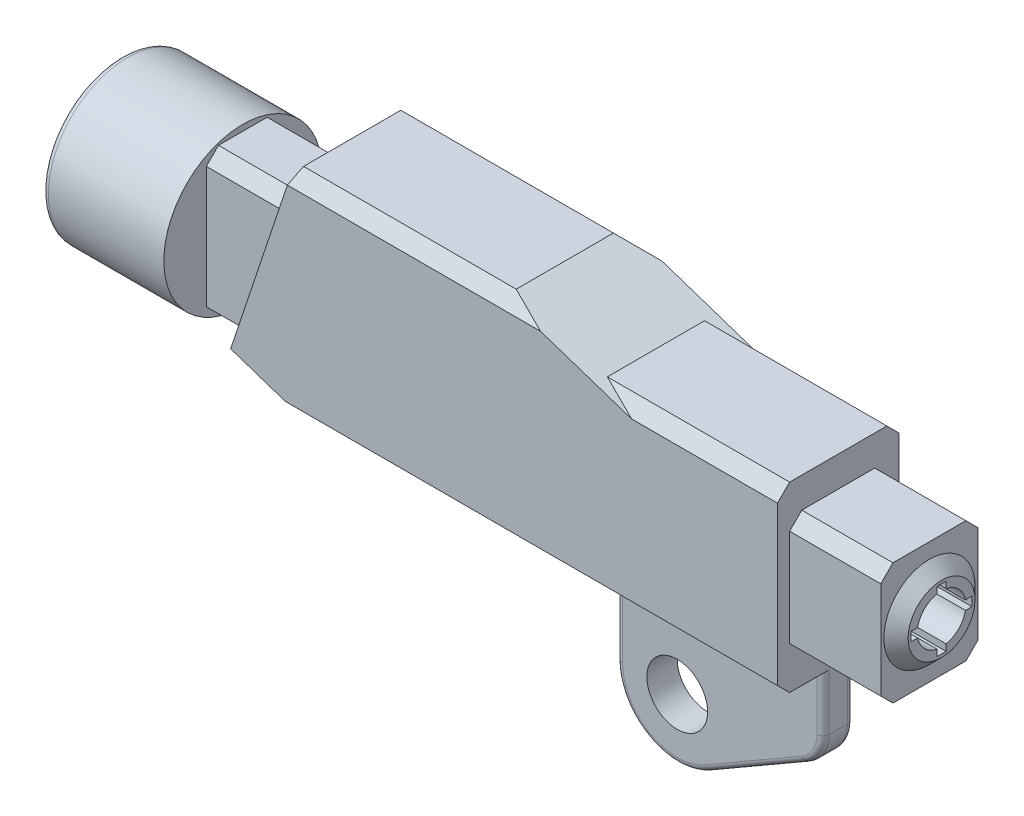
from build123d import *

# Parameters (mm, degrees)
SKETCH1_R           = 13
BOSS_EXTRUDE1_DEPTH = 20
SKETCH2_R           = 4
CUT_EXTRUDE1_DEPTH  = 15
SKETCH3_W           = 12
SKETCH3_H           = 24
BOSS_EXTRUDE2_DEPTH = 70
CHAMFER1_SIZE       = 2
BOSS_EXTRUDE3_DEPTH = 10
CHAMFER2_SIZE       = 2
SKETCH5_W           = 16
SKETCH5_H           = 20
BOSS_EXTRUDE4_DEPTH = 15
CHAMFER3_SIZE       = 2
SKETCH6_R           = 7.5
BOSS_EXTRUDE5_DEPTH = 2
CUT_EXTRUDE2_START  = -20
CUT_EXTRUDE2_DEPTH  = 20
CHAMFER4_SIZE       = 2
SKETCH8_R           = 5
BOSS_EXTRUDE6_DEPTH = 2.5
FILLET1_R           = 1
FILLET2_R           = 1


# Some blends are built 0.0001 mm under size
with BuildPart() as part:
    # Sketch1 → Boss-Extrude1 (new body)
    with BuildSketch(Plane(origin=(0, 0, 0), x_dir=(0, 0, -1), z_dir=(1, 0, 0))):
        Circle(SKETCH1_R)
    extrude(amount=BOSS_EXTRUDE1_DEPTH)

    # Sketch2 → Cut-Extrude1 (cut)
    with BuildSketch(Plane.ZY):
        Circle(SKETCH2_R)
    extrude(amount=-CUT_EXTRUDE1_DEPTH, mode=Mode.SUBTRACT)

    # Sketch3 → Boss-Extrude2 (add)
    with BuildSketch(Plane(origin=(20, 0, 0), x_dir=(0, 0, -1), z_dir=(1, 0, 0))):
        Rectangle(SKETCH3_W, SKETCH3_H)
    extrude(amount=BOSS_EXTRUDE2_DEPTH)

    # Chamfer1
    # the kernel refuses this chamfer: 2 mm, written as the material it takes off along each edge
    with BuildSketch(Plane(origin=(20, -12, -6), x_dir=(0, 0.9996219169112968, -0.027495876610586487), z_dir=(1, 0, 0)), Plane(origin=(20, 12, 6), x_dir=(0, -0.9996219169112968, 0.027495876610586487), z_dir=(1, 0, 0)), Plane(origin=(20, -12, 6), x_dir=(0, -0.027495876610586494, -0.9996219169112968), z_dir=(1, 0, 0))) as chamfer1_piece_1:
        Polygon((CHAMFER1_SIZE * 0.999621916911, CHAMFER1_SIZE * 0.0274958766106), (-CHAMFER1_SIZE * 0.0274958766106, CHAMFER1_SIZE * 0.999621916911), (0, 0), align=None)
    extrude(amount=75.143365976, mode=Mode.SUBTRACT)
    with BuildSketch(Plane(origin=(20, 12, -6), x_dir=(0, -0.9996219169112968, -0.027495876610586487), z_dir=(1, 0, 0))) as chamfer1_piece_2:
        Polygon((CHAMFER1_SIZE * 0.999621916911, -CHAMFER1_SIZE * 0.0274958766106), (-CHAMFER1_SIZE * 0.0274958766106, -CHAMFER1_SIZE * 0.999621916911), (0, 0), align=None)
    extrude(amount=75.143365976, mode=Mode.SUBTRACT)

    # Sketch4 → Boss-Extrude3 (add, symmetric)
    with BuildSketch(Plane.XY):
        Polygon((28, -10), (38, 20), (73, 20), (88, 15), (118, 15), (118, -15), (43, -15), align=None)
    extrude(amount=BOSS_EXTRUDE3_DEPTH, both=True)

    # Chamfer2
    chamfer2_edges = [part.edges().sort_by_distance(p)[0] for p in [
        (80.5, -15, -10),
        (103, 15, -10),
        (55.5, 20, -10),
        (80.5, -15, 10),
        (103, 15, 10),
        (55.5, 20, 10),
    ]]
    chamfer(chamfer2_edges, length=CHAMFER2_SIZE)

    # Sketch5 → Boss-Extrude4 (add)
    with BuildSketch(Plane(origin=(118, 0, 0), x_dir=(0, 0, -1), z_dir=(1, 0, 0))):
        Rectangle(SKETCH5_W, SKETCH5_H)
    extrude(amount=BOSS_EXTRUDE4_DEPTH)

    # Chamfer3
    chamfer3_edges = [part.edges().sort_by_distance(p)[0] for p in [
        (125.5, -10, -8),
        (125.5, 10, -8),
        (125.5, 10, 8),
        (125.5, -10, 8),
    ]]
    chamfer(chamfer3_edges, length=CHAMFER3_SIZE)

    # Sketch6 → Boss-Extrude5 (add)
    with BuildSketch(Plane(origin=(133, 0, 0), x_dir=(0, 0, -1), z_dir=(1, 0, 0))):
        with Locations(Location((0, 0, 0), (0, 0, 90))):
            Circle(SKETCH6_R)
    extrude(amount=BOSS_EXTRUDE5_DEPTH)

    # Sketch7 → Cut-Extrude2 (cut)
    with BuildSketch(Plane(origin=(135, 0, 0), x_dir=(0, 0, -1), z_dir=(1, 0, 0)).offset(CUT_EXTRUDE2_START)):
        with BuildLine():
            Line((5, -0.75), (5, 0.75))
            Line((5, 0.75), (3.929058411, 0.75))
            ThreePointArc((3.929058411, 0.75), (2.828427125, 2.828427125), (0.75, 3.929058411))
            Line((0.75, 3.929058411), (0.75, 5))
            Line((0.75, 5), (-0.75, 5))
            Line((-0.75, 5), (-0.75, 3.929058411))
            ThreePointArc((-0.75, 3.929058411), (-2.828427125, 2.828427125), (-3.929058411, 0.75))
            Line((-3.929058411, 0.75), (-5, 0.75))
            Line((-5, 0.75), (-5, -0.75))
            Line((-5, -0.75), (-3.929058411, -0.75))
            ThreePointArc((-3.929058411, -0.75), (-2.828427125, -2.828427125), (-0.75, -3.929058411))
            Line((-0.75, -3.929058411), (-0.75, -5))
            Line((-0.75, -5), (0.75, -5))
            Line((0.75, -5), (0.75, -3.929058411))
            ThreePointArc((0.75, -3.929058411), (2.828427125, -2.828427125), (3.929058411, -0.75))
            Line((3.929058411, -0.75), (5, -0.75))
        make_face()
    extrude(amount=CUT_EXTRUDE2_DEPTH, mode=Mode.SUBTRACT)

    # Chamfer4
    chamfer4_edges = [part.edges().sort_by_distance(p)[0] for p in [
        (135, -7.5, 0),
    ]]
    chamfer(chamfer4_edges, length=CHAMFER4_SIZE - 0.0001)  # a hair under: the kernel refuses the full size

    # Sketch8 → Boss-Extrude6 (add, symmetric)
    with BuildSketch(Plane.XY):
        with BuildLine():
            Line((118, -15), (84, -15))
            Line((84, -15), (84, -30))
            ThreePointArc((84, -30), (89, -38.660254038), (99, -38.660254038))
            Line((99, -38.660254038), (115, -29.422649731))
            ThreePointArc((115, -29.422649731), (117.196152423, -27.226497308), (118, -24.226497308))
            Line((118, -24.226497308), (118, -15))
        make_face()
        with Locations((94, -30)):
            Circle(SKETCH8_R, mode=Mode.SUBTRACT)
    extrude(amount=BOSS_EXTRUDE6_DEPTH, both=True)

    # Fillet1
    fillet1_edges = [part.edges().sort_by_distance(p)[0] for p in [
        (0, 0, 13),
    ]]
    fillet(fillet1_edges, radius=FILLET1_R)

    # Fillet2
    fillet2_edges = [part.edges().sort_by_distance(p)[0] for p in [
        (107, -34.041451884, -2.5),
        (117.196152423, -27.226497308, -2.5),
        (118, -19.613248654, 2.5),
        (84, -22.5, -2.5),
        (89, -38.660254038, -2.5),
        (107, -34.041451884, 2.5),
        (117.196152423, -27.226497308, 2.5),
        (84, -22.5, 2.5),
        (89, -38.660254038, 2.5),
        (118, -19.613248654, -2.5),
    ]]
    fillet(fillet2_edges, radius=FILLET2_R)


solid = part.part
